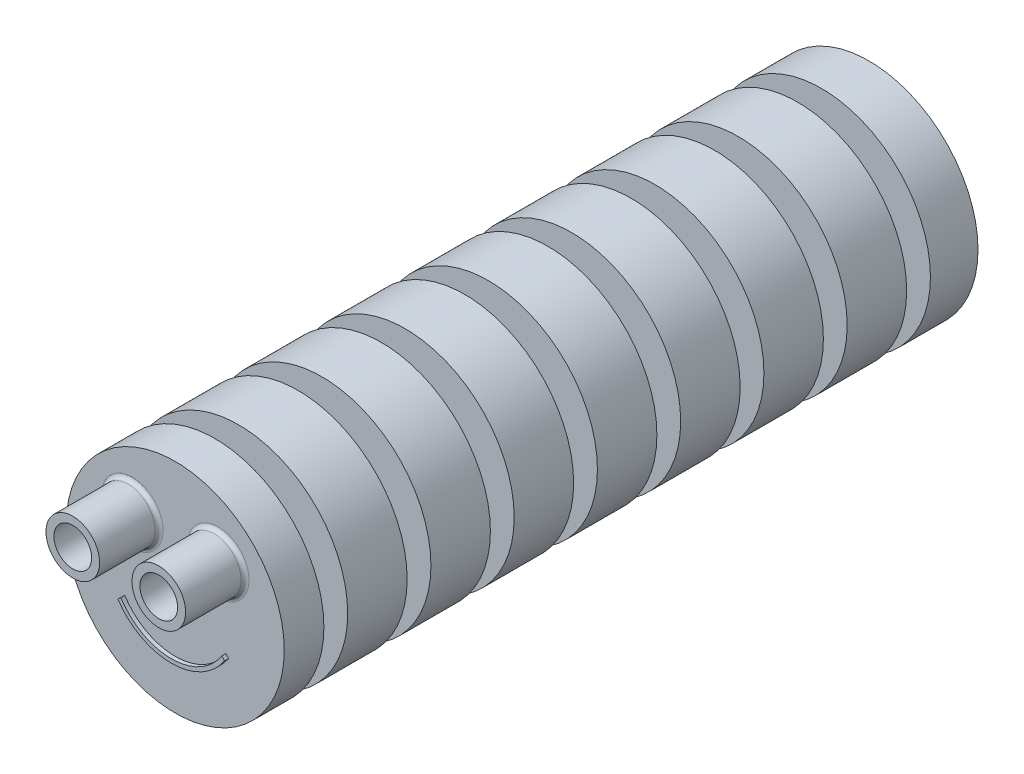
from build123d import *
from build123d.topology import SkipClean

# Parameters (mm, degrees)
SKETCH3_R             = 27.5
BOSS_EXTRUDE2_DEPTH   = 175
SKETCH5_R             = 3.175
CUT_EXTRUDE1_DEPTH    = 180.26935042
SKETCH4_W             = 16
SKETCH4_H             = 6
SHELL1_START          = 3
SHELL1_OUTLINE_R      = 8.5
SHELL1_OUTLINE_R_2    = 6.175
SHELL1_DEPTH          = 169
SHELL1_START_2        = 21
SHELL1_2_OUTLINE_R    = 24.5
SHELL1_2_OUTLINE_R_2  = 8.5
SHELL1_2_DEPTH        = 9
SHELL1_START_3        = 42
SHELL1_3_OUTLINE_R    = 24.5
SHELL1_3_OUTLINE_R_2  = 8.5
SHELL1_3_DEPTH        = 9
SHELL1_START_4        = 63
SHELL1_4_OUTLINE_R    = 24.5
SHELL1_4_OUTLINE_R_2  = 8.5
SHELL1_4_DEPTH        = 9
SHELL1_START_5        = 84
SHELL1_5_OUTLINE_R    = 24.5
SHELL1_5_OUTLINE_R_2  = 8.5
SHELL1_5_DEPTH        = 9
SHELL1_START_6        = 105
SHELL1_6_OUTLINE_R    = 24.5
SHELL1_6_OUTLINE_R_2  = 8.5
SHELL1_6_DEPTH        = 9
SHELL1_START_7        = 126
SHELL1_7_OUTLINE_R    = 24.5
SHELL1_7_OUTLINE_R_2  = 8.5
SHELL1_7_DEPTH        = 9
SHELL1_START_8        = 147
SHELL1_8_OUTLINE_R    = 24.5
SHELL1_8_OUTLINE_R_2  = 8.5
SHELL1_8_DEPTH        = 9
SHELL1_9_OUTLINE_R    = 24.5
SHELL1_9_OUTLINE_R_2  = 8.5
SHELL1_9_DEPTH        = 6
SHELL1_START_9        = 168
SHELL1_10_OUTLINE_R   = 24.5
SHELL1_10_OUTLINE_R_2 = 8.5
SHELL1_10_DEPTH       = 4
BOSS_EXTRUDE3_REACH   = 181.269
SKETCH11_W            = 6
SKETCH11_H            = 18.622661507
SKETCH11_H_2          = 18.562635142
SKETCH11_H_3          = 18.723636058
SKETCH11_H_4          = 19.102872432
SKETCH11_H_5          = 19.443952445
SKETCH11_H_6          = 20.46765219
SKETCH11_H_7          = 19.166783548
SKETCH11_H_8          = 20.128295153
SKETCH12_W            = 1.25
SKETCH12_H            = 4
SKETCH12_H_2          = 6
SKETCH12_H_3          = 9
SKETCH13_R            = 6.7625
SKETCH13_R_2          = 4.7625
BOSS_EXTRUDE4_DEPTH   = 15
CUT_EXTRUDE2_START    = -18
SKETCH14_R            = 4.7625
CUT_EXTRUDE2_DEPTH    = 18
CIRPATTERN1_COUNT     = 2
CIRPATTERN1_ANGLE     = 90
FILLET1_R             = 1
BOSS_EXTRUDE5_DEPTH   = 1


# Read off the part's stored shape, not the designer's step: Shell1
with BuildPart() as part:
    # Sketch3 → Boss-Extrude2 (new body)
    with BuildSketch(Plane.XY):
        Circle(SKETCH3_R)
    extrude(amount=BOSS_EXTRUDE2_DEPTH)

    # Sketch5 → Cut-Extrude1 (cut, through all)
    with BuildSketch(Plane.XY.offset(175)):
        Circle(SKETCH5_R)
    extrude(amount=-CUT_EXTRUDE1_DEPTH, mode=Mode.SUBTRACT)

    # Sketch4 → Cut-Revolve1 (revolve, cut)
    with BuildSketch(Plane(origin=(0, 0, 0), x_dir=(1, 0, 0), z_dir=(0, 1, 0)), mode=Mode.PRIVATE) as cut_revolve1_sk:
        with Locations((-19.5, -162)):
            Rectangle(SKETCH4_W, SKETCH4_H)
        with Locations((-19.5, -141)):
            Rectangle(SKETCH4_W, SKETCH4_H)
        with Locations((-19.5, -120)):
            Rectangle(SKETCH4_W, SKETCH4_H)
        with Locations((-19.5, -99)):
            Rectangle(SKETCH4_W, SKETCH4_H)
        with Locations((-19.5, -78)):
            Rectangle(SKETCH4_W, SKETCH4_H)
        with Locations((-19.5, -57)):
            Rectangle(SKETCH4_W, SKETCH4_H)
        with Locations((-19.5, -36)):
            Rectangle(SKETCH4_W, SKETCH4_H)
        with Locations((-19.5, -15)):
            Rectangle(SKETCH4_W, SKETCH4_H)
    revolve(cut_revolve1_sk.sketch.rotate(Axis((0, 0, 175), (0, 0, -1)), 180), axis=Axis((0, 0, 175), (0, 0, -1)), mode=Mode.SUBTRACT)

    # Shell1 outline → Shell1 (cut)
    with BuildSketch(Plane.XY.offset(SHELL1_START)):
        Circle(SHELL1_OUTLINE_R)
        Circle(SHELL1_OUTLINE_R_2, mode=Mode.SUBTRACT)
    extrude(amount=SHELL1_DEPTH, mode=Mode.SUBTRACT)

    # Shell1 2 outline → Shell1 2 (cut)
    with BuildSketch(Plane.XY.offset(SHELL1_START_2)):
        Circle(SHELL1_2_OUTLINE_R)
        Circle(SHELL1_2_OUTLINE_R_2, mode=Mode.SUBTRACT)
    extrude(amount=SHELL1_2_DEPTH, mode=Mode.SUBTRACT)

    # Shell1 3 outline → Shell1 3 (cut)
    with BuildSketch(Plane.XY.offset(SHELL1_START_3)):
        Circle(SHELL1_3_OUTLINE_R)
        Circle(SHELL1_3_OUTLINE_R_2, mode=Mode.SUBTRACT)
    extrude(amount=SHELL1_3_DEPTH, mode=Mode.SUBTRACT)

    # Shell1 4 outline → Shell1 4 (cut)
    with BuildSketch(Plane.XY.offset(SHELL1_START_4)):
        Circle(SHELL1_4_OUTLINE_R)
        Circle(SHELL1_4_OUTLINE_R_2, mode=Mode.SUBTRACT)
    extrude(amount=SHELL1_4_DEPTH, mode=Mode.SUBTRACT)

    # Shell1 5 outline → Shell1 5 (cut)
    with BuildSketch(Plane.XY.offset(SHELL1_START_5)):
        Circle(SHELL1_5_OUTLINE_R)
        Circle(SHELL1_5_OUTLINE_R_2, mode=Mode.SUBTRACT)
    extrude(amount=SHELL1_5_DEPTH, mode=Mode.SUBTRACT)

    # Shell1 6 outline → Shell1 6 (cut)
    with BuildSketch(Plane.XY.offset(SHELL1_START_6)):
        Circle(SHELL1_6_OUTLINE_R)
        Circle(SHELL1_6_OUTLINE_R_2, mode=Mode.SUBTRACT)
    extrude(amount=SHELL1_6_DEPTH, mode=Mode.SUBTRACT)

    # Shell1 7 outline → Shell1 7 (cut)
    with BuildSketch(Plane.XY.offset(SHELL1_START_7)):
        Circle(SHELL1_7_OUTLINE_R)
        Circle(SHELL1_7_OUTLINE_R_2, mode=Mode.SUBTRACT)
    extrude(amount=SHELL1_7_DEPTH, mode=Mode.SUBTRACT)

    # Shell1 8 outline → Shell1 8 (cut)
    with BuildSketch(Plane.XY.offset(SHELL1_START_8)):
        Circle(SHELL1_8_OUTLINE_R)
        Circle(SHELL1_8_OUTLINE_R_2, mode=Mode.SUBTRACT)
    extrude(amount=SHELL1_8_DEPTH, mode=Mode.SUBTRACT)

    # Shell1 9 outline → Shell1 9 (cut)
    with BuildSketch(Plane.XY.offset(SHELL1_START)):
        Circle(SHELL1_9_OUTLINE_R)
        Circle(SHELL1_9_OUTLINE_R_2, mode=Mode.SUBTRACT)
    extrude(amount=SHELL1_9_DEPTH, mode=Mode.SUBTRACT)

    # Shell1 10 outline → Shell1 10 (cut)
    with BuildSketch(Plane.XY.offset(SHELL1_START_9)):
        Circle(SHELL1_10_OUTLINE_R)
        Circle(SHELL1_10_OUTLINE_R_2, mode=Mode.SUBTRACT)
    extrude(amount=SHELL1_10_DEPTH, mode=Mode.SUBTRACT)

    # Boss-Extrude3: up to this face of the body (flat: up to its plane)
    boss_extrude3_end = Plane(part.part.faces().sort_by_distance((-26.722182541, 0, 175))[0])
    # Sketch10 → Boss-Extrude3 (add, up to the picked face)
    with BuildSketch(Plane(origin=(0, 0, 0), x_dir=(-1, 0, 0), z_dir=(0, 0, -1)), mode=Mode.PRIVATE) as boss_extrude3_sk1:
        with BuildLine():
            Line((-1, 27.481812167), (-1, 3.01340754))
            ThreePointArc((-1, 3.01340754), (0, 3.175), (1, 3.01340754))
            Line((1, 3.01340754), (1, 27.481812167))
            ThreePointArc((1, 27.481812167), (0, 27.5), (-1, 27.481812167))
        make_face()
    boss_extrude3_tool1 = split(extrude(boss_extrude3_sk1.sketch, amount=-BOSS_EXTRUDE3_REACH, mode=Mode.PRIVATE), bisect_by=boss_extrude3_end, keep=Keep.BOTH, mode=Mode.PRIVATE)
    # Sketch10 → Boss-Extrude3 (add, up to the picked face)
    with BuildSketch(Plane(origin=(0, 0, 0), x_dir=(-1, 0, 0), z_dir=(0, 0, -1)), mode=Mode.PRIVATE) as boss_extrude3_sk2:
        with BuildLine():
            Line((3.01340754, 1), (27.481812167, 1))
            ThreePointArc((27.481812167, 1), (27.5, 0), (27.481812167, -1))
            Line((27.481812167, -1), (3.01340754, -1))
            ThreePointArc((3.01340754, -1), (3.175, 0), (3.01340754, 1))
        make_face()
    boss_extrude3_tool2 = split(extrude(boss_extrude3_sk2.sketch, amount=-BOSS_EXTRUDE3_REACH, mode=Mode.PRIVATE), bisect_by=boss_extrude3_end, keep=Keep.BOTH, mode=Mode.PRIVATE)
    # Sketch10 → Boss-Extrude3 (add, up to the picked face)
    with BuildSketch(Plane(origin=(0, 0, 0), x_dir=(-1, 0, 0), z_dir=(0, 0, -1)), mode=Mode.PRIVATE) as boss_extrude3_sk3:
        with BuildLine():
            Line((-1, -3.01340754), (-1, -27.481812167))
            ThreePointArc((-1, -27.481812167), (0, -27.5), (1, -27.481812167))
            Line((1, -27.481812167), (1, -3.01340754))
            ThreePointArc((1, -3.01340754), (0, -3.175), (-1, -3.01340754))
        make_face()
    boss_extrude3_tool3 = split(extrude(boss_extrude3_sk3.sketch, amount=-BOSS_EXTRUDE3_REACH, mode=Mode.PRIVATE), bisect_by=boss_extrude3_end, keep=Keep.BOTH, mode=Mode.PRIVATE)
    # Sketch10 → Boss-Extrude3 (add, up to the picked face)
    with BuildSketch(Plane(origin=(0, 0, 0), x_dir=(-1, 0, 0), z_dir=(0, 0, -1)), mode=Mode.PRIVATE) as boss_extrude3_sk4:
        with BuildLine():
            Line((-27.481812167, -1), (-3.01340754, -1))
            ThreePointArc((-3.01340754, -1), (-3.175, 0), (-3.01340754, 1))
            Line((-3.01340754, 1), (-27.481812167, 1))
            ThreePointArc((-27.481812167, 1), (-27.5, 0), (-27.481812167, -1))
        make_face()
    boss_extrude3_tool4 = split(extrude(boss_extrude3_sk4.sketch, amount=-BOSS_EXTRUDE3_REACH, mode=Mode.PRIVATE), bisect_by=boss_extrude3_end, keep=Keep.BOTH, mode=Mode.PRIVATE)
    add(boss_extrude3_tool1.solids().sort_by(Axis((0, 15.307771, 0), (0, 0, 1)))[0])
    add(boss_extrude3_tool2.solids().sort_by(Axis((-15.307771, 0, 0), (0, 0, 1)))[0])
    add(boss_extrude3_tool3.solids().sort_by(Axis((0, -15.307771, 0), (0, 0, 1)))[0])
    add(boss_extrude3_tool4.solids().sort_by(Axis((15.307771, 0, 0), (0, 0, 1)))[0])

    # Sketch11 → Cut-Revolve2 (revolve, cut)
    with BuildSketch(Plane(origin=(0, 0, 0), x_dir=(0, 0, -1), z_dir=(1, 0, 0)), mode=Mode.PRIVATE) as cut_revolve2_sk:
        with Locations((-162, 20.76776999)):
            Rectangle(SKETCH11_W, SKETCH11_H)
        with Locations((-141, 20.737756808)):
            Rectangle(SKETCH11_W, SKETCH11_H_2)
        with Locations((-120, 20.837335447)):
            Rectangle(SKETCH11_W, SKETCH11_H_3)
        with Locations((-99, 21.007875453)):
            Rectangle(SKETCH11_W, SKETCH11_H_4)
        with Locations((-78, 21.197493641)):
            Rectangle(SKETCH11_W, SKETCH11_H_5)
        with Locations((-57, 21.690265332)):
            Rectangle(SKETCH11_W, SKETCH11_H_6)
        with Locations((-36, 21.039831011)):
            Rectangle(SKETCH11_W, SKETCH11_H_7)
        with Locations((-15, 21.520586814)):
            Rectangle(SKETCH11_W, SKETCH11_H_8)
    revolve(cut_revolve2_sk.sketch.rotate(Axis((0, 0, 174.128746248), (0, 0, -1)), 90), axis=Axis((0, 0, 174.128746248), (0, 0, -1)), mode=Mode.SUBTRACT)

    # Sketch12 → Revolve1 (revolve)
    with BuildSketch(Plane(origin=(0, 0, 0), x_dir=(1, 0, 0), z_dir=(0, 1, 0))):
        with Locations((24.10458333, -170)):
            Rectangle(SKETCH12_W, SKETCH12_H)
        with Locations((24.10458333, -6)):
            Rectangle(SKETCH12_W, SKETCH12_H_2)
        with Locations((24.10458333, -151.5)):
            Rectangle(SKETCH12_W, SKETCH12_H_3)
        with Locations((24.10458333, -130.5)):
            Rectangle(SKETCH12_W, SKETCH12_H_3)
        with Locations((24.10458333, -109.5)):
            Rectangle(SKETCH12_W, SKETCH12_H_3)
        with Locations((24.10458333, -88.5)):
            Rectangle(SKETCH12_W, SKETCH12_H_3)
        with Locations((24.10458333, -67.5)):
            Rectangle(SKETCH12_W, SKETCH12_H_3)
        with Locations((24.10458333, -46.5)):
            Rectangle(SKETCH12_W, SKETCH12_H_3)
        with Locations((24.10458333, -25.5)):
            Rectangle(SKETCH12_W, SKETCH12_H_3)
    revolve(axis=Axis((0, 0, 0), (0, 0, 1)))

    # Sketch13 → Boss-Extrude4 (add)
    with BuildSketch(Plane.XY.offset(175)):
        with Locations((10.845250256, 10.845250256)):
            Circle(SKETCH13_R)
        with Locations((10.845250256, 10.845250256)):
            Circle(SKETCH13_R_2, mode=Mode.SUBTRACT)
    boss_extrude4 = extrude(amount=BOSS_EXTRUDE4_DEPTH)

    # Sketch14 → Cut-Extrude2 (cut)
    with BuildSketch(Plane.XY.offset(190).offset(CUT_EXTRUDE2_START)):
        with Locations((10.845250256, 10.845250256)):
            Circle(SKETCH14_R)
    cut_extrude2 = extrude(amount=CUT_EXTRUDE2_DEPTH, mode=Mode.SUBTRACT)

    # CirPattern1: Boss-Extrude4, Cut-Extrude2 ×2 about axis
    cirpattern1_axis = Axis((0, 0, 174.128746248), (0, 0, 1))
    add([boss_extrude4.rotate(cirpattern1_axis, i * CIRPATTERN1_ANGLE / (CIRPATTERN1_COUNT - 1)) for i in range(1, CIRPATTERN1_COUNT)])
    add([cut_extrude2.rotate(cirpattern1_axis, i * CIRPATTERN1_ANGLE / (CIRPATTERN1_COUNT - 1)) for i in range(1, CIRPATTERN1_COUNT)], mode=Mode.SUBTRACT)

    # Fillet1
    fillet1_edges = [part.edges().sort_by_distance(p)[0] for p in [
        (4.082750256, 10.845250256, 175),
        (-10.845250256, 4.082750256, 175),
    ]]
    fillet(fillet1_edges, radius=FILLET1_R)

    # Sketch15 → Boss-Extrude5 (add)
    with SkipClean():  # the faces are left unmerged after this step: merging them gives an invalid solid
        with BuildSketch(Plane.XY.offset(175)):
            with BuildLine():
                Line((-12.73203153, -8.134198241), (-13.453098199, -8.827063928))
                ThreePointArc((-13.453098199, -8.827063928), (-0.020445175, -16.090447188), (13.430622743, -8.861223475))
                Line((13.430622743, -8.861223475), (12.73203153, -8.134198241))
                ThreePointArc((12.73203153, -8.134198241), (0, -15.108600462), (-12.73203153, -8.134198241))
            make_face()
        extrude(amount=BOSS_EXTRUDE5_DEPTH)


solid = part.part
